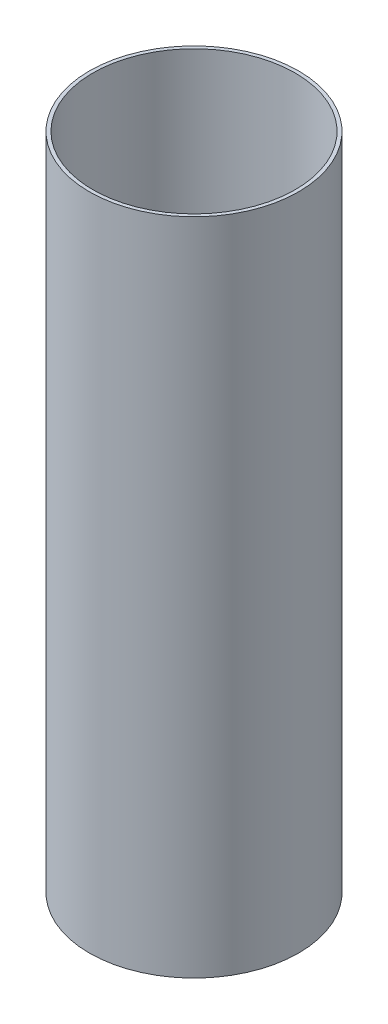
from build123d import *

# Parameters (mm, degrees)
SKETCH1_W = 3.175
SKETCH1_H = 600


with BuildPart() as part:
    # Sketch1 → Revolve1 (revolve)
    with BuildSketch(Plane.XY):
        with Locations((93.6625, 300)):
            Rectangle(SKETCH1_W, SKETCH1_H)
    revolve(axis=Axis((0, 0, 0), (0, 1, 0)))


solid = part.part
